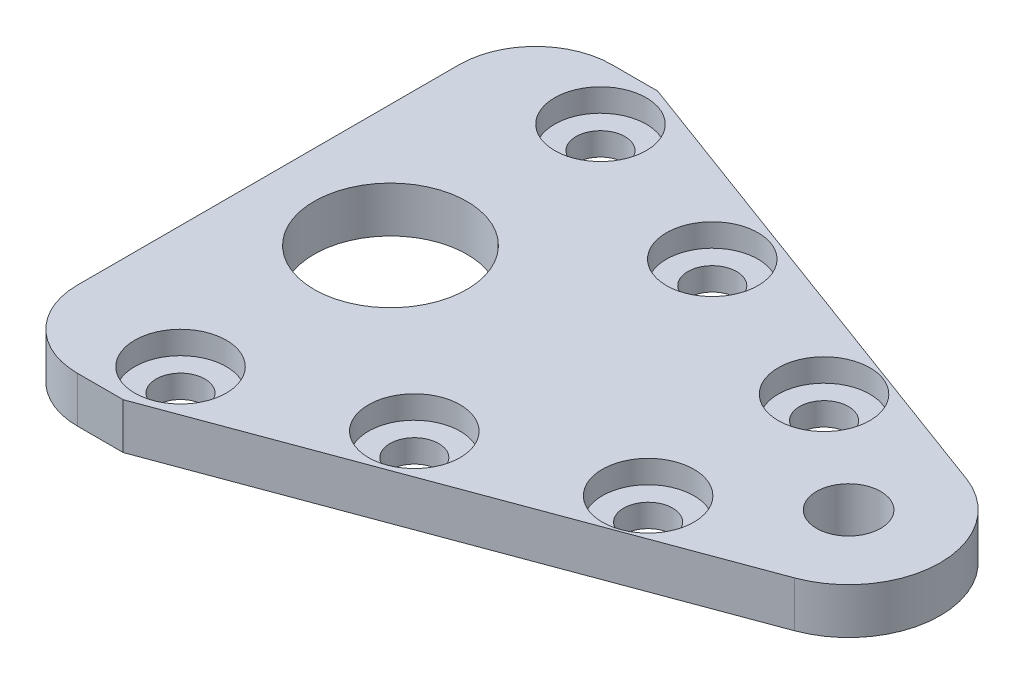
from build123d import *

# Parameters (mm, degrees)
SKETCH1_R           = 5
SKETCH1_R_2         = 2.1
BOSS_EXTRUDE1_DEPTH = 3
SKETCH3_R           = 1.6
CUT_EXTRUDE1_DEPTH  = 10
FILLET1_R           = 5
SKETCH4_R           = 3
CUT_EXTRUDE2_DEPTH  = 1.5


with BuildPart() as part:
    # Sketch1 → Boss-Extrude1 (new body)
    with BuildSketch(Plane(origin=(0, 0, 0), x_dir=(1, 0, 0), z_dir=(0, 1, 0))):
        with BuildLine():
            Line((-8, 17.5), (-8, -17.5))
            Line((-8, -17.5), (0, -17.5))
            Line((0, -17.5), (32.082434223, -5.627030097))
            ThreePointArc((32.082434223, -5.627030097), (36, 0), (32.082434223, 5.627030097))
            Line((32.082434223, 5.627030097), (0, 17.5))
            Line((0, 17.5), (-8, 17.5))
        make_face()
        Circle(SKETCH1_R, mode=Mode.SUBTRACT)
        with Locations((30, 0)):
            Circle(SKETCH1_R_2, mode=Mode.SUBTRACT)
    extrude(amount=BOSS_EXTRUDE1_DEPTH)

    # Sketch3 → Cut-Extrude1 (cut)
    with BuildSketch(Plane(origin=(0, 3, 0), x_dir=(1, 0, 0), z_dir=(0, 1, 0))):
        with Locations((0, 13.75)):
            Circle(SKETCH3_R)
        with Locations((11.315438541, 9.754896669)):
            Circle(SKETCH3_R)
        with Locations((22.630877082, 5.759793337)):
            Circle(SKETCH3_R)
        with Locations((22.630877082, -5.759793337)):
            Circle(SKETCH3_R)
        with Locations((0, -13.75)):
            Circle(SKETCH3_R)
        with Locations((11.315438541, -9.754896669)):
            Circle(SKETCH3_R)
    extrude(amount=-CUT_EXTRUDE1_DEPTH, mode=Mode.SUBTRACT)

    # Fillet1
    fillet1_edges = [part.edges().sort_by_distance(p)[0] for p in [
        (-8, 1.5, 17.5),
        (-8, 1.5, -17.5),
    ]]
    fillet(fillet1_edges, radius=FILLET1_R)

    # Sketch4 → Cut-Extrude2 (cut)
    with BuildSketch(Plane(origin=(0, 3, 0), x_dir=(1, 0, 0), z_dir=(0, 1, 0))):
        with Locations((0, 13.75)):
            Circle(SKETCH4_R)
        with Locations((11.315438541, 9.754896669)):
            Circle(SKETCH4_R)
        with Locations((22.630877082, 5.759793337)):
            Circle(SKETCH4_R)
        with Locations((22.630877082, -5.759793337)):
            Circle(SKETCH4_R)
        with Locations((11.315438541, -9.754896669)):
            Circle(SKETCH4_R)
        with Locations((0, -13.75)):
            Circle(SKETCH4_R)
    extrude(amount=-CUT_EXTRUDE2_DEPTH, mode=Mode.SUBTRACT)


solid = part.part
